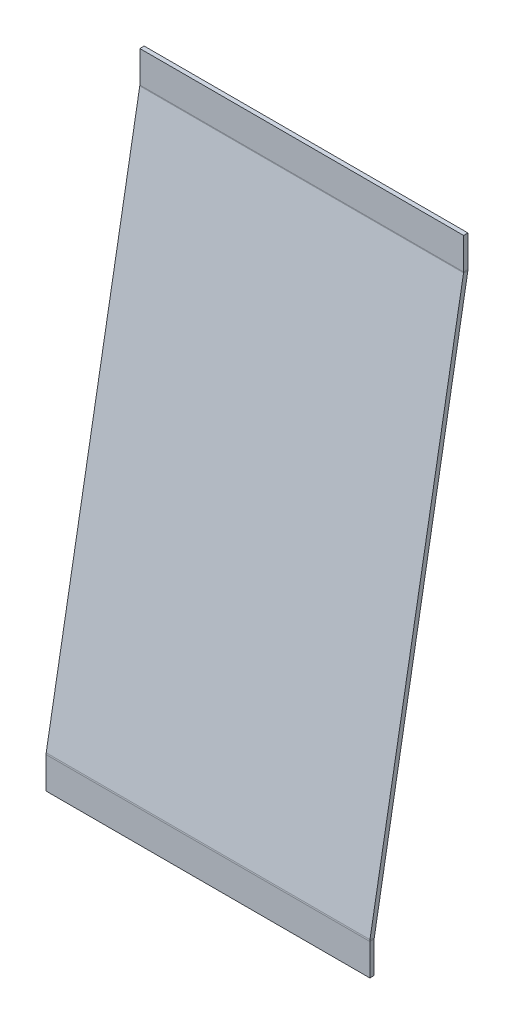
from build123d import *

# Parameters (mm, degrees)
BOSS_EXTRUDE1_DEPTH          = 30
EDGE_FLANGE1_STRIP_CUT_DEPTH = 30
EDGE_FLANGE1_DEPTH           = 30
EDGE_FLANGE2_STRIP_CUT_DEPTH = 30
EDGE_FLANGE2_DEPTH           = 30


# Sheet-metal steps are written as plain solids
with BuildPart() as part:
    # Sketch1 → Boss-Extrude1 (new body)
    with BuildSketch(Plane(origin=(0, 0, 0), x_dir=(0, 0, -1), z_dir=(1, 0, 0))):
        Polygon((0.196961551, -0.034729636), (8.879370434, 49.205658015), (8.485447333, 49.275117286), (-0.196961551, 0.034729636), align=None)
    extrude(amount=BOSS_EXTRUDE1_DEPTH)

    # Edge-Flange1 strip (across the edge) → Edge-Flange1 strip cut (cut)
    with BuildSketch(Plane(origin=(30, 49.275117286, -8.485447333), x_dir=(0, 0, 1), z_dir=(-1, 0, 0))):
        Polygon((-0.804601829, 2.259615531), (-0.387846202, -0.103923077), (0.006076899, -0.034463806), (-0.410678728, 2.329074802), align=None)
    extrude(amount=EDGE_FLANGE1_STRIP_CUT_DEPTH, mode=Mode.SUBTRACT)

    # Edge-Flange1 section (across the edge) → Edge-Flange1 (add)
    with BuildSketch(Plane(origin=(30, 49.275117286, -8.485447333), x_dir=(0, 0, 1), z_dir=(-1, 0, 0))):
        with BuildLine():
            Line((-0.4, 0.034995465), (-0.4, 2.965004535))
            Line((-0.4, 2.965004535), (0, 2.965004535))
            Line((0, 2.965004535), (0, 0.034995465))
            ThreePointArc((0, 0.034995465), (0.001522121, 0.000133168), (0.006076899, -0.034463806))
            Line((0.006076899, -0.034463806), (-0.387846202, -0.103923077))
            ThreePointArc((-0.387846202, -0.103923077), (-0.396955758, -0.034729129), (-0.4, 0.034995465))
        make_face()
    extrude(amount=EDGE_FLANGE1_DEPTH)

    # Edge-Flange2 strip (across the edge) → Edge-Flange2 strip cut (cut)
    with BuildSketch(Plane(origin=(30, -0.034729636, -0.196961551), x_dir=(0, 0, -1), z_dir=(-1, 0, 0))):
        Polygon((-0.804601829, 2.259615531), (-0.387846202, -0.103923077), (0.006076899, -0.034463806), (-0.410678728, 2.329074802), align=None)
    extrude(amount=EDGE_FLANGE2_STRIP_CUT_DEPTH, mode=Mode.SUBTRACT)

    # Edge-Flange2 section (across the edge) → Edge-Flange2 (add)
    with BuildSketch(Plane(origin=(30, -0.034729636, -0.196961551), x_dir=(0, 0, -1), z_dir=(-1, 0, 0))):
        with BuildLine():
            Line((-0.4, 0.034995465), (-0.4, 2.965004535))
            Line((-0.4, 2.965004535), (0, 2.965004535))
            Line((0, 2.965004535), (0, 0.034995465))
            ThreePointArc((0, 0.034995465), (0.001522121, 0.000133168), (0.006076899, -0.034463806))
            Line((0.006076899, -0.034463806), (-0.387846202, -0.103923077))
            ThreePointArc((-0.387846202, -0.103923077), (-0.396955758, -0.034729129), (-0.4, 0.034995465))
        make_face()
    extrude(amount=EDGE_FLANGE2_DEPTH)


solid = part.part
